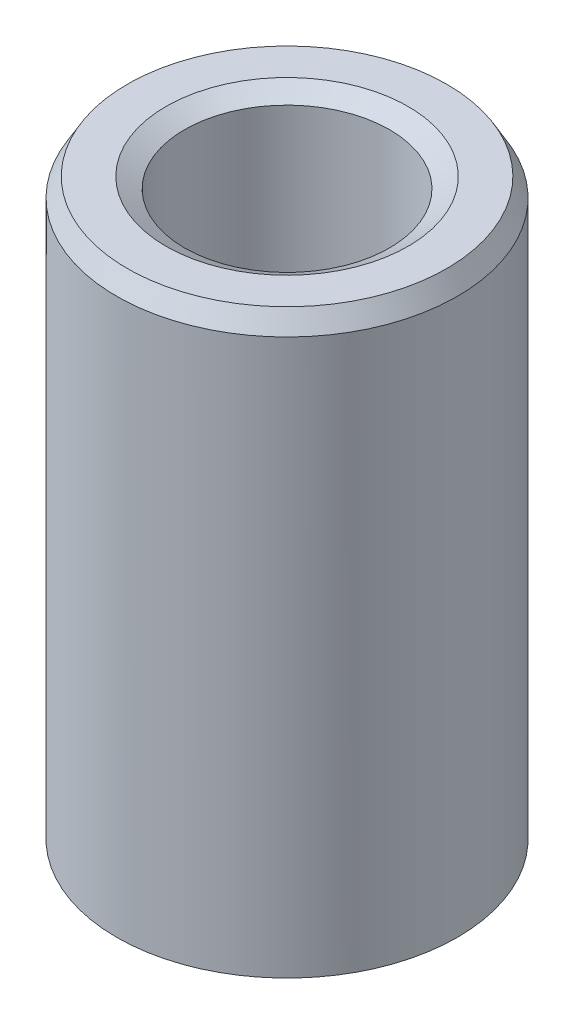
from build123d import *
from OCP.BRepFilletAPI import BRepFilletAPI_MakeChamfer

# Parameters (mm, degrees)
SKETCH1_R           = 32.5
BOSS_EXTRUDE1_DEPTH = 111.465143797
SKETCH2_R           = 19.544940381
CUT_EXTRUDE1_DEPTH  = 121.569391977
CHAMFER1_SIZE       = 3.548974007
CHAMFER1_SIZE2      = 2.049001098


with BuildPart() as part:
    # Sketch1 → Boss-Extrude1 (new body)
    with BuildSketch(Plane(origin=(0, 0, 0), x_dir=(1, 0, 0), z_dir=(0, 1, 0))):
        Circle(SKETCH1_R)
    extrude(amount=BOSS_EXTRUDE1_DEPTH)

    # Sketch2 → Cut-Extrude1 (cut, through all)
    with BuildSketch(Plane(origin=(0, 0, 0), x_dir=(1, 0, 0), z_dir=(0, 1, 0))):
        Circle(SKETCH2_R)
    extrude(amount=CUT_EXTRUDE1_DEPTH, mode=Mode.SUBTRACT)

    # Chamfer1: one chamfer whose edges measure the first distance from different faces: ONE call of the kernel's chamfer builder (chamfer() names one face for all edges)
    chamfer1_edges_1 = [part.edges().sort_by_distance(p)[0] for p in [
        (-19.544940381, 111.465143797, 0),
    ]]
    chamfer1_side_1 = [part.faces().sort_by_distance(p)[0] for p in [
        (-31.580761184, 111.465143797, 0),
    ]]
    chamfer1_edges_2 = [part.edges().sort_by_distance(p)[0] for p in [
        (-19.544940381, 0, 0),
    ]]
    chamfer1_side_2 = [part.faces().sort_by_distance(p)[0] for p in [
        (-19.544940381, 55.732571898, 0),
    ]]
    chamfer1_edges_3 = [part.edges().sort_by_distance(p)[0] for p in [
        (-32.5, 0, 0),
    ]]
    chamfer1_side_3 = [part.faces().sort_by_distance(p)[0] for p in [
        (-31.580761184, 0, 0),
    ]]
    chamfer1_edges_4 = [part.edges().sort_by_distance(p)[0] for p in [
        (-32.5, 111.465143797, 0),
    ]]
    chamfer1_side_4 = [part.faces().sort_by_distance(p)[0] for p in [
        (-32.5, 55.732571898, 0),
    ]]
    chamfer1 = BRepFilletAPI_MakeChamfer(part.part.solid().wrapped)
    for e in chamfer1_edges_1:
        chamfer1.Add(CHAMFER1_SIZE, CHAMFER1_SIZE2, e.wrapped, chamfer1_side_1[0].wrapped)  # the first distance lies on this face
    for e in chamfer1_edges_2:
        chamfer1.Add(CHAMFER1_SIZE, CHAMFER1_SIZE2, e.wrapped, chamfer1_side_2[0].wrapped)  # the first distance lies on this face
    for e in chamfer1_edges_3:
        chamfer1.Add(CHAMFER1_SIZE, CHAMFER1_SIZE2, e.wrapped, chamfer1_side_3[0].wrapped)  # the first distance lies on this face
    for e in chamfer1_edges_4:
        chamfer1.Add(CHAMFER1_SIZE, CHAMFER1_SIZE2, e.wrapped, chamfer1_side_4[0].wrapped)  # the first distance lies on this face
    add(Compound.cast(chamfer1.Shape()), mode=Mode.REPLACE)


solid = part.part
